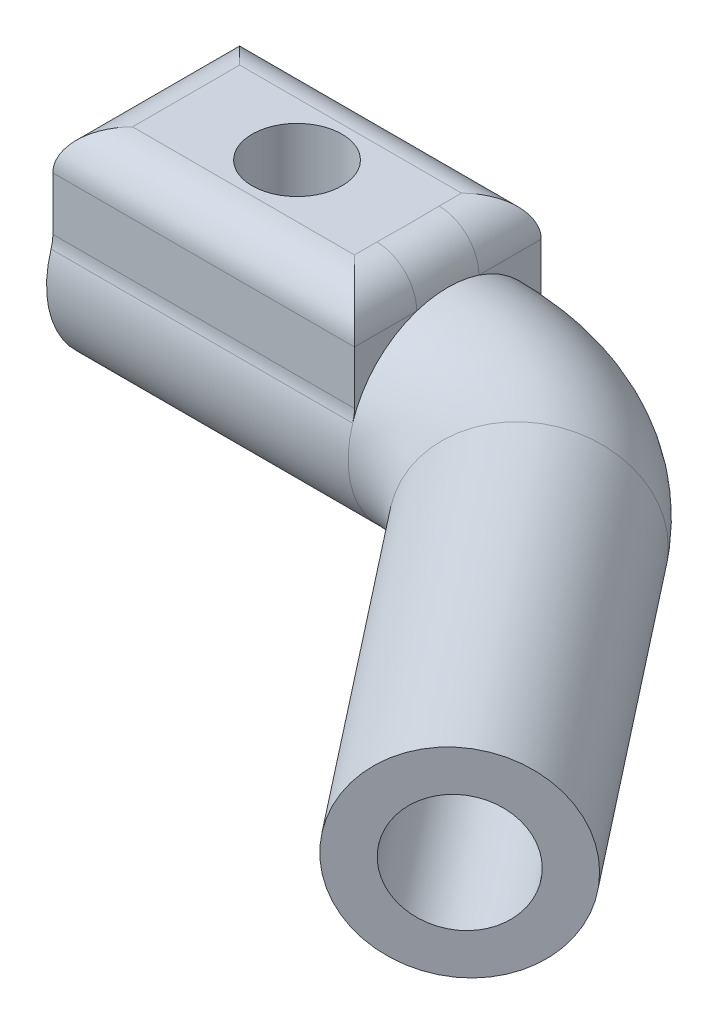
from build123d import *

# Parameters (mm, degrees)
SKETCH2_R           = 5
CUT_EXTRUDE1_DEPTH  = 12.5
SKETCH5_R           = 2.95
CUT_EXTRUDE3_DEPTH  = 10
SKETCH14_W          = 15.128379637
SKETCH14_H          = 10
CUT_EXTRUDE4_DEPTH  = 5
SKETCH15_W          = 15.128379637
SKETCH15_H          = 9.367496998
BOSS_EXTRUDE3_DEPTH = 5
FILLET2_R           = 2
FILLET3_R           = 2
CUT_EXTRUDE5_REACH  = 48.953
SKETCH16_R          = 2.25


with BuildPart() as part:
    # Sweep1: sweep along a path in Sketch1
    with BuildLine(Plane(origin=(0, 0, 0), x_dir=(1, 0, 0), z_dir=(0, 1, 0))) as sweep1_path:
        Line((0, 0), (15.128379637, 0))
        ThreePointArc((15.128379637, 0), (19.50794708, -1.010039543), (23.002807262, -3.836122196))
        Line((23.002807262, -3.836122196), (35.409694509, -19.686069062))
    # Sketch2 → Sweep1 (sweep)
    with BuildSketch(Plane(origin=(0, 0, 0), x_dir=(0, 0, -1), z_dir=(1, 0, 0))):
        Circle(SKETCH2_R)
    sweep(path=sweep1_path.line)

    # Sketch4 → Cut-Extrude1 (cut)
    with BuildSketch(Plane.ZY):
        with BuildLine():
            Line((-2.497999199, 1.75), (2.497999199, 1.75))
            ThreePointArc((2.497999199, 1.75), (0, -3.05), (-2.497999199, 1.75))
        make_face()
    extrude(amount=-CUT_EXTRUDE1_DEPTH, mode=Mode.SUBTRACT)

    # Sketch5 → Cut-Extrude3 (cut)
    with BuildSketch(Plane(origin=(23.008372425, 0, 29.393470993), x_dir=(0.7874427624920404, 0, -0.6163877803776647), z_dir=(0.6163877803776646, 0, 0.7874427624920403))):
        with Locations((15.74885525, 0)):
            Circle(SKETCH5_R)
    extrude(amount=-CUT_EXTRUDE3_DEPTH, mode=Mode.SUBTRACT)

    # Sketch14 → Cut-Extrude4 (cut)
    with BuildSketch(Plane.XZ.offset(-1.75)):
        with Locations((7.564189819, 0)):
            Rectangle(SKETCH14_W, SKETCH14_H)
    extrude(amount=-CUT_EXTRUDE4_DEPTH, mode=Mode.SUBTRACT)

    # Sketch15 → Boss-Extrude3 (add)
    with BuildSketch(Plane(origin=(0, 1.75, 0), x_dir=(1, 0, 0), z_dir=(0, 1, 0))):
        with Locations((7.564189819, 0)):
            Rectangle(SKETCH15_W, SKETCH15_H)
    extrude(amount=BOSS_EXTRUDE3_DEPTH)

    # Fillet2
    fillet2_edges = [part.edges().sort_by_distance(p)[0] for p in [
        (7.564189819, 1.75, -4.683748499),
        (7.564189819, 1.75, 4.683748499),
    ]]
    fillet(fillet2_edges, radius=FILLET2_R)

    # Fillet3
    fillet3_edges = [part.edges().sort_by_distance(p)[0] for p in [
        (7.564189819, 6.75, -4.683748499),
        (15.128379637, 6.75, 0),
        (7.564189819, 6.75, 4.683748499),
        (0, 6.75, 0),
    ]]
    fillet(fillet3_edges, radius=FILLET3_R)

    # Sketch16 → Cut-Extrude5 (cut, up to next)
    with BuildSketch(Plane(origin=(0, 6.75, 0), x_dir=(1, 0, 0), z_dir=(0, 1, 0)), mode=Mode.PRIVATE) as cut_extrude5_sk1:
        with Locations((7.564189819, 0)):
            Circle(SKETCH16_R)
    cut_extrude5_tool1 = extrude(cut_extrude5_sk1.sketch, amount=-CUT_EXTRUDE5_REACH, mode=Mode.PRIVATE) & part.part
    add(cut_extrude5_tool1.solids().sort_by_distance((7.56419, 6.75, 0))[0], mode=Mode.SUBTRACT)


solid = part.part
